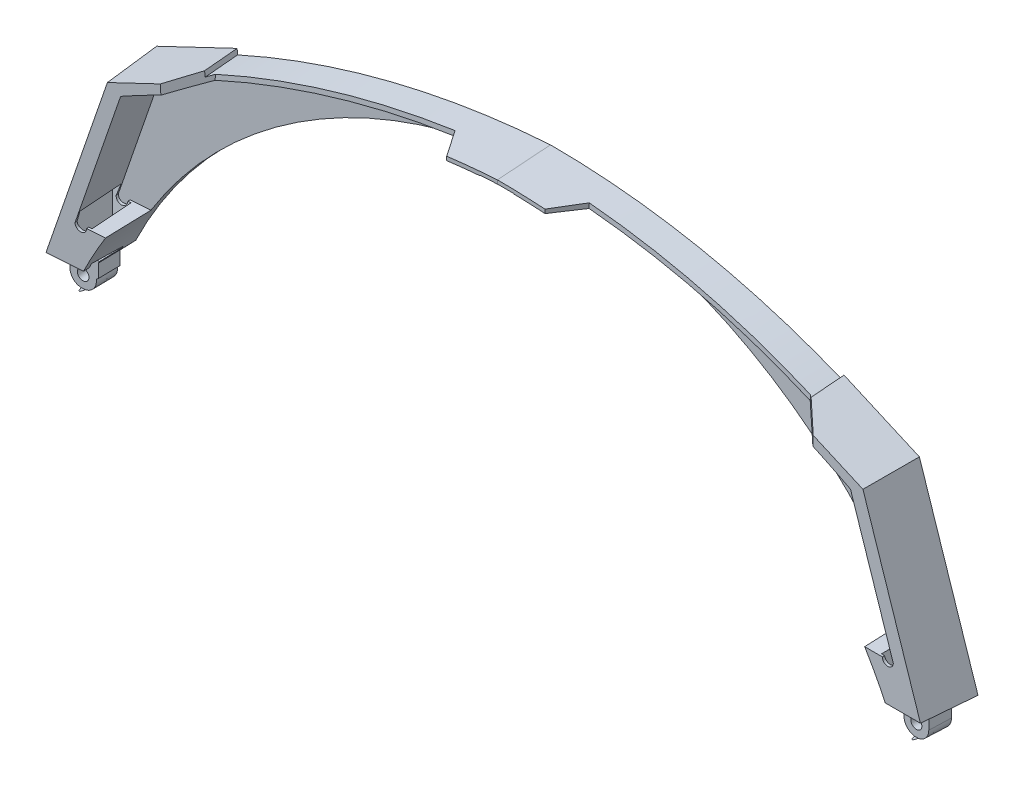
from build123d import *

# Parameters (mm, degrees)
ESQUISSE1_R             = 0.75
BOSS_EXTRU_1_DEPTH      = 10
BOSS_EXTRU_1_DRAFT      = 2
ESQUISSE2_W             = 13.85789223
ESQUISSE2_H             = 8.60111757
ENL_V_MAT_EXTRU_1_DEPTH = 13
ESQUISSE5_W             = 12.990785821
ESQUISSE5_H             = 5.57811828
ENL_V_MAT_EXTRU_3_DEPTH = 13
ENL_V_MAT_EXTRU_4_DEPTH = 18.5
ESQUISSE8_W             = 3.624703647
ESQUISSE8_H             = 8.1
ENL_V_MAT_EXTRU_7_DEPTH = 9
ENL_V_MAT_EXTRU_7_DRAFT = -6
ENL_V_MAT_EXTRU_8_DEPTH = 6.5
ENL_V_MAT_EXTRU_6_DEPTH = 24
ESQUISSE12_R            = 1.011324244
ENL_V_MAT_EXTRU_9_DEPTH = 6
ESQUISSE17_R            = 0.825
BOSS_EXTRU_2_DEPTH      = 2


# Read off the part's stored shape, not the designer's step: Symétrie2
with BuildPart() as part:
    # Esquisse1 → Boss.-Extru.1 (with draft: the straight prism first)
    with BuildSketch(Plane.XY):
        with BuildLine():
            Line((77.8887043, -44.926917936), (67.208968034, -12.647772451))
            Line((67.208968034, -12.647772451), (53.475934981, -6.614216024))
            Line((53.475934981, -6.614216024), (53.395110551, -7.610944377))
            ThreePointArc((53.395110551, -7.610944377), (27.216820071, 0.300239401), (0, 2.971274119))
            Line((0, 2.971274119), (0, 0))
            ThreePointArc((0, 0), (41.918820025, -12.179976378), (70.783627584, -44.926917936))
            Line((70.783627584, -44.926917936), (70.783627584, -47.429888392))
            Line((70.783627584, -47.429888392), (71.170117615, -47.747103549))
            ThreePointArc((71.170117615, -47.747103549), (73.573677122, -50.425298655), (76.163642587, -47.926917936))
            Line((76.163642587, -47.926917936), (76.163642587, -44.926917936))
            Line((76.163642587, -44.926917936), (77.8887043, -44.926917936))
        make_face()
        with Locations((73.663642587, -47.926917936)):
            Circle(ESQUISSE1_R, mode=Mode.SUBTRACT)
    extrude(amount=BOSS_EXTRU_1_DEPTH)
    # Boss.-Extru.1: the draft: its side faces are tilted about the plane it starts from
    boss_extru_1_sides = [part.faces().sort_by_distance(p)[0] for p in [
        (72.548836167, -28.787345194, 5),
        (60.342451508, -9.630994237, 5),
        (53.435522766, -7.1125802, 5),
        (27.216820071, 0.300239401, 5),
        (0, 1.48563706, 5),
        (41.918820025, -12.179976378, 5),
        (70.783627584, -46.178403164, 5),
        (70.9768726, -47.588495971, 5),
        (73.573677122, -50.425298655, 5),
        (76.163642587, -46.426917936, 5),
        (77.026173444, -44.926917936, 5),
        (72.913642587, -47.926917936, 5),
    ]]
    draft(boss_extru_1_sides, Plane.XY, BOSS_EXTRU_1_DRAFT)

    # Esquisse2 → Enlèv. mat.-Extru.1 (cut)
    with BuildSketch(Plane(origin=(0, 0, -10), x_dir=(-1, 0, 0), z_dir=(0, 0, -1))):
        with Locations((-70.959758185, -49.227476721)):
            Rectangle(ESQUISSE2_W, ESQUISSE2_H)
    extrude(amount=-ENL_V_MAT_EXTRU_1_DEPTH, mode=Mode.SUBTRACT)

    # Esquisse5 → Enlèv. mat.-Extru.3 (cut)
    with BuildSketch(Plane.XY.offset(20)):
        with Locations((70.909949533, -47.366769381)):
            Rectangle(ESQUISSE5_W, ESQUISSE5_H)
    extrude(amount=-ENL_V_MAT_EXTRU_3_DEPTH, mode=Mode.SUBTRACT)

    # Esquisse6 → Enlèv. mat.-Extru.4 (cut)
    with BuildSketch(Plane.XY.offset(20)):
        with BuildLine():
            Line((64.669985027, -14.044516655), (72.45607407, -37.577710241))
            ThreePointArc((72.45607407, -37.577710241), (71.45607407, -38.577710241), (70.45607407, -37.577710241))
            Line((70.45607407, -37.577710241), (2.849207695, -37.577710241))
            Line((2.849207695, -37.577710241), (2.849207695, 1.892851629))
            ThreePointArc((2.849207695, 1.892851629), (34.687321508, -2.477202631), (64.669985027, -14.044516655))
        make_face()
    extrude(amount=-ENL_V_MAT_EXTRU_4_DEPTH, mode=Mode.SUBTRACT)


with BuildPart() as enl_v_mat_extru_7_tool:
    # Esquisse8 → Enlèv. mat.-Extru.7 (with draft: the straight prism first)
    with BuildSketch(Plane(origin=(0, -35.577710241, 0), x_dir=(1, 0, 0), z_dir=(0, 1, 0))):
        with Locations((71.507795019, -5.75)):
            Rectangle(ESQUISSE8_W, ESQUISSE8_H)
    extrude(amount=-ENL_V_MAT_EXTRU_7_DEPTH)
    # Enlèv. mat.-Extru.7: the draft: its side faces are tilted about the plane it starts from
    enl_v_mat_extru_7_sides = [enl_v_mat_extru_7_tool.faces().sort_by_distance(p)[0] for p in [
        (69.695443195, -40.077710241, 5.75),
        (71.507795019, -40.077710241, 9.8),
        (73.320146842, -40.077710241, 5.75),
        (71.507795019, -40.077710241, 1.7),
    ]]
    draft(enl_v_mat_extru_7_sides, Plane(origin=(0, -35.577710241, 0), x_dir=(1, 0, 0), z_dir=(0, 1, 0)), ENL_V_MAT_EXTRU_7_DRAFT)


with BuildPart() as part_1:
    add(part.part)

    # Enlèv. mat.-Extru.7: cut by enl_v_mat_extru_7_tool
    add(enl_v_mat_extru_7_tool.part, mode=Mode.SUBTRACT)

    # Esquisse9 → Enlèv. mat.-Extru.8 (cut)
    with BuildSketch(Plane(origin=(0, -4.896564999, 0.170991818), x_dir=(0.9999999998537095, -5.969561417335715e-07, -1.7094587273474584e-05), z_dir=(0, 0.9993908270190958, -0.03489949670250105))):
        with BuildLine():
            Line((3.349657801, -1.114368939), (0.03533908, -1.114368939))
            Line((0.03533908, -1.114368939), (0.119413388, -3.518714663))
            ThreePointArc((0.119413388, -3.518714663), (1.002393791, -4.338878244), (0.178858385, -5.218714663))
            Line((0.178858385, -5.218714663), (0.349657801, -10.103213324))
            Line((0.349657801, -10.103213324), (3.349657801, -10.111959186))
            Line((3.349657801, -10.111959186), (3.349657801, -1.114368939))
        make_face()
    extrude(amount=ENL_V_MAT_EXTRU_8_DEPTH, mode=Mode.SUBTRACT)

    # Esquisse7 → Enlèv. mat.-Extru.6 (cut)
    with BuildSketch(Plane(origin=(0, 5.097343272, -0.178003149), x_dir=(0.9999999998537095, -5.969561417335715e-07, -1.7094587273474584e-05), z_dir=(0, 0.9993908270190958, -0.03489949670250105))):
        Polygon((12, -5.000000781), (9, -10.085416779), (58.325804645, -10.085411957), (52.617108891, -5.000000781), align=None)
    extrude(amount=-ENL_V_MAT_EXTRU_6_DEPTH, mode=Mode.SUBTRACT)

    # Symétrie2: part across plane


with BuildPart() as part_2:
    add(part_1.part)
    add(part_1.part.mirror(Plane(origin=(0, 0, 0), x_dir=(0.034899496702501046, 0, 0.9993908270190957), z_dir=(-0.9993908270190958, 0, 0.034899496702501046))))

    # Esquisse12 → Enlèv. mat.-Extru.9 (cut)
    with BuildSketch(Plane(origin=(0, -4.896564999, 0.170991818), x_dir=(0.9999999998537095, -5.969561417335715e-07, -1.7094587273474584e-05), z_dir=(0, 0.9993908270190958, -0.03489949670250105))):
        with Locations((0.159665326, -4.247929052)):
            Circle(ESQUISSE12_R)
    extrude(amount=ENL_V_MAT_EXTRU_9_DEPTH, mode=Mode.SUBTRACT)

    # Esquisse17 → Boss.-Extru.2 (add)
    with BuildSketch(Plane(origin=(0, 1.099779964, -0.038405163), x_dir=(-1, 0, 0), z_dir=(0, -0.9993908270190958, 0.03489949670250106))):
        with Locations(Location((-0.146292507, -4.268691639, 0), (0, 0, 9.44628294))):
            Circle(ESQUISSE17_R)
    extrude(amount=BOSS_EXTRU_2_DEPTH)


solid = part_2.part
